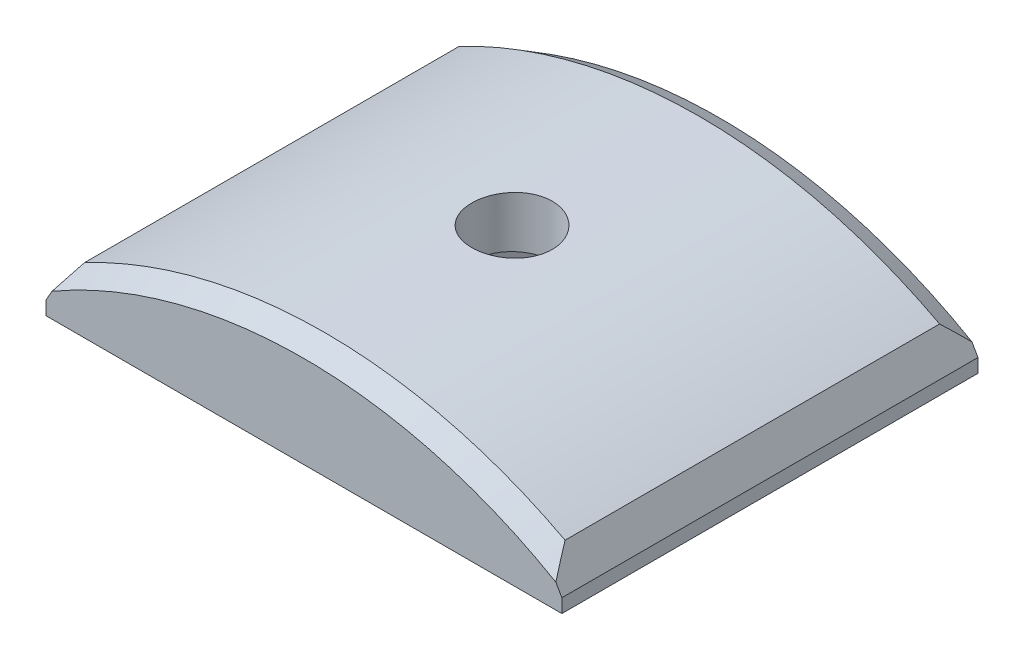
from build123d import *

# Parameters (mm, degrees)
BOSS_EXTRUDE1_DEPTH   = 25.4
CUT_EXTRUDE1_REACH    = 329.931
F_8_CLEARANCE_HOLE1_D = 4.9149
CHAMFER1_SIZE         = 1.275307785
CHAMFER1_SIZE_2       = 1.27
CHAMFER1_SIZE_3       = 0.733234842
CUT_EXTRUDE2_DEPTH    = 3.175


with BuildPart() as part:
    # Sketch1 → Boss-Extrude1 (new body)
    with BuildSketch(Plane.XY):
        with BuildLine():
            Line((-288.860017795, -12.750441382), (-326.696640794, -12.750441382))
            ThreePointArc((-326.696640794, -12.750441382), (-307.778329294, -6.400441382), (-288.860017795, -12.750441382))
        make_face()
    extrude(amount=-BOSS_EXTRUDE1_DEPTH)

    # Sketch2 → Cut-Extrude1 (cut, up to next)
    with BuildSketch(Plane.XY, mode=Mode.PRIVATE) as cut_extrude1_sk1:
        with BuildLine():
            Line((-292.035017795, -12.750441382), (-292.035017795, -10.639114407))
            ThreePointArc((-292.035017795, -10.639114407), (-290.415395998, -11.646473343), (-288.860017795, -12.750441382))
            Line((-288.860017795, -12.750441382), (-292.035017795, -12.750441382))
        make_face()
    cut_extrude1_tool1 = extrude(cut_extrude1_sk1.sketch, amount=-CUT_EXTRUDE1_REACH, mode=Mode.PRIVATE) & part.part
    # Sketch2 → Cut-Extrude1 (cut, up to next)
    with BuildSketch(Plane.XY, mode=Mode.PRIVATE) as cut_extrude1_sk2:
        with BuildLine():
            Line((-323.521640794, -12.750441382), (-326.696640794, -12.750441382))
            ThreePointArc((-326.696640794, -12.750441382), (-325.14126259, -11.646473343), (-323.521640794, -10.639114407))
            Line((-323.521640794, -10.639114407), (-323.521640794, -12.750441382))
        make_face()
    cut_extrude1_tool2 = extrude(cut_extrude1_sk2.sketch, amount=-CUT_EXTRUDE1_REACH, mode=Mode.PRIVATE) & part.part
    add(cut_extrude1_tool1.solids().sort_by_distance((-290.95384, -12.03102, 0))[0], mode=Mode.SUBTRACT)
    add(cut_extrude1_tool2.solids().sort_by_distance((-324.602819, -12.03102, 0))[0], mode=Mode.SUBTRACT)

    # #8 Clearance Hole1 (through all)
    with Locations(Plane(origin=(0, -12.750441382, 0), x_dir=(-1, 0, 0), z_dir=(0, -1, 0))):
        with Locations((307.778329294, 12.7)):
            Hole(F_8_CLEARANCE_HOLE1_D / 2)

    # Chamfer1
    # the kernel refuses this chamfer: 1.275307785, 1.27, 0.733234842 mm, written as the material it takes off along each edge
    with BuildSketch(Plane(origin=(-292.035017795, -10.639114407, 3.299478256), x_dir=(-0.8744921081912179, 0.4850397434347821, 0), z_dir=(0, 0, -1))) as chamfer1_piece_1:
        with BuildLine():
            Line((1.228549666, 0), (-CHAMFER1_SIZE * 0.485039743592, -CHAMFER1_SIZE * 0.874492108474))
            Line((-CHAMFER1_SIZE * 0.485039743592, -CHAMFER1_SIZE * 0.874492108474), (0, 0))
            ThreePointArc((0, 0), (0.636104744, 0.006009849), (1.228549666, 0))
        make_face()
    extrude(amount=31.998956511, mode=Mode.SUBTRACT)
    with BuildSketch(Plane(origin=(-323.521640794, -10.639114407, 3.286063629), x_dir=(0.8745288770995413, 0.4849734457875147, 0), z_dir=(0, 0, -1))) as chamfer1_piece_2:
        with BuildLine():
            Line((1.233303065, 0), (-CHAMFER1_SIZE_2 * 0.484973445787, CHAMFER1_SIZE_2 * 0.8745288771))
            Line((-CHAMFER1_SIZE_2 * 0.484973445787, CHAMFER1_SIZE_2 * 0.8745288771), (0, 0))
            ThreePointArc((0, 0), (0.638512102, -0.006056486), (1.233303065, 0))
        make_face()
    extrude(amount=31.972127259, mode=Mode.SUBTRACT)
    # the kernel refuses this chamfer: 1.275307785, 1.27, 0.733234842 mm, written as the material it takes off along each edge
    with BuildSketch(Plane(origin=(-307.778329294, -37.756741382, -25.4), x_dir=(-0.5575773235938082, 0.8301250075825723, 0), z_dir=(-0.8301250075825723, -0.5575773235938082, 0))) as chamfer1_2_piece_1:
        Polygon((31.3563, -CHAMFER1_SIZE_2), (31.3563 - CHAMFER1_SIZE_3, 0), (31.3563, 0), align=None)
    revolve(axis=Axis((-307.778329294, -37.756741382, -25.4), (0, 0, -1)), revolution_arc=67.785524428, mode=Mode.SUBTRACT)
    with BuildSketch(Plane(origin=(-307.778329294, -37.756741382, 0), x_dir=(-0.5575773235938082, 0.8301250075825723, 0), z_dir=(-0.8301250075825723, -0.5575773235938082, 0))) as chamfer1_2_piece_2:
        Polygon((31.3563, CHAMFER1_SIZE_2), (31.3563 - CHAMFER1_SIZE_3, 0), (31.3563, 0), align=None)
    revolve(axis=Axis((-307.778329294, -37.756741382, 0), (0, 0, -1)), revolution_arc=67.785524428, mode=Mode.SUBTRACT)

    # Sketch5 → Cut-Extrude2 (cut)
    with BuildSketch(Plane.XZ.offset(12.750441382)):
        Polygon((-310.417974725, -17.272), (-305.138683864, -17.272), (-302.499038433, -12.7), (-305.138683864, -8.128), (-310.417974725, -8.128), (-313.057620156, -12.7), align=None)
    extrude(amount=-CUT_EXTRUDE2_DEPTH, mode=Mode.SUBTRACT)


solid = part.part
